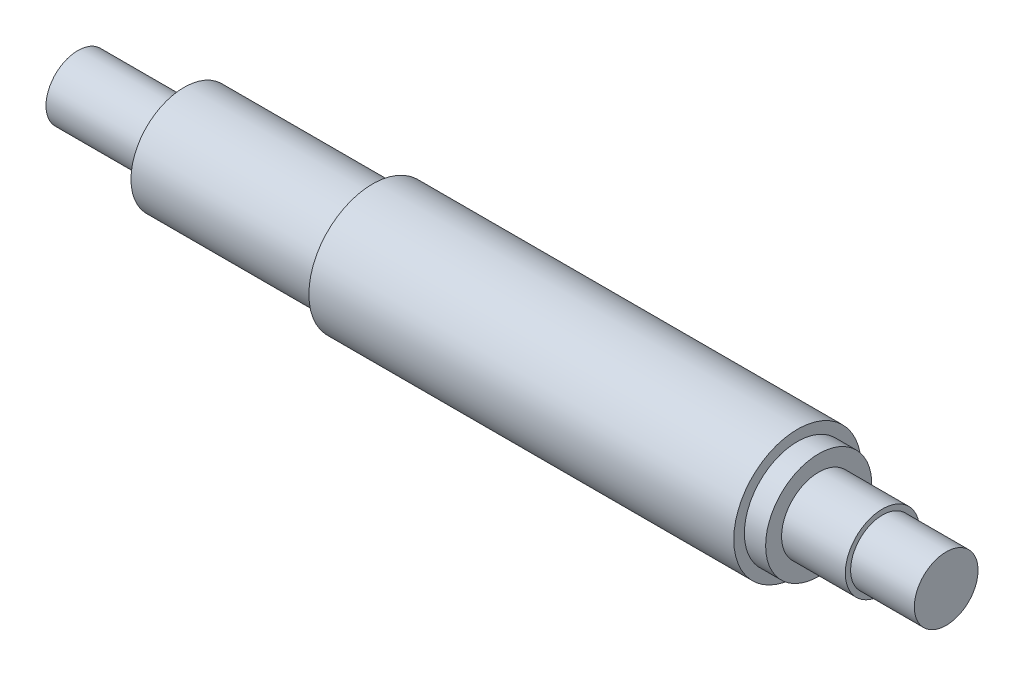
from build123d import *


with BuildPart() as part:
    # Sketch2 → Revolve1 (revolve)
    with BuildSketch(Plane.XY):
        Polygon((-40.875, 0), (40.875, 0), (40.875, 3), (34.875, 3), (34.875, 3.5), (28.875, 3.5), (28.875, 5), (26.875, 5), (26.875, 6), (-13.125, 6), (-13.125, 5), (-30.875, 5), (-30.875, 3), (-40.875, 3), align=None)
    revolve(axis=Axis((-40.875, 0, 0), (1, 0, 0)))


solid = part.part
